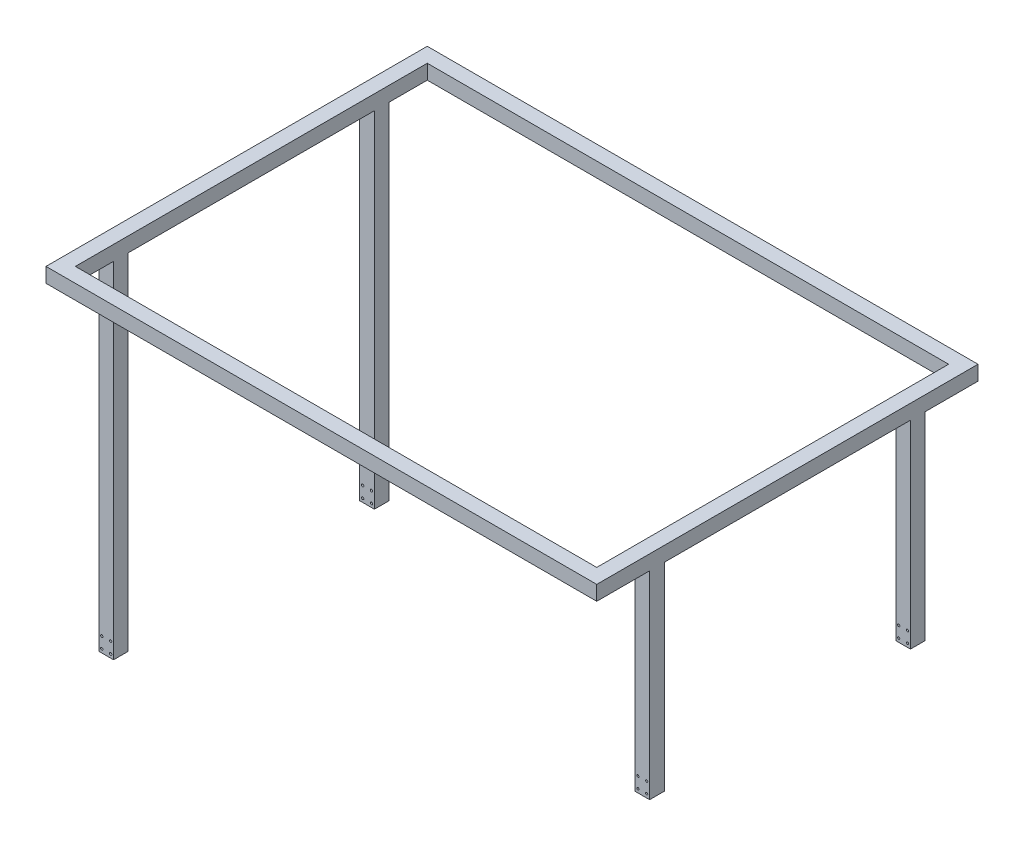
from build123d import *

# Parameters (mm, degrees)
SKETCH_1_W      = 750
SKETCH_1_H      = 519.2
SKETCH_1_W_2    = 710
SKETCH_1_H_2    = 479.2
EXTRUDE_1_DEPTH = 20
SKETCH_2_W      = 20
SKETCH_2_H      = 20
EXTRUDE_2_DEPTH = 470
SKETCH_6_W      = 20
SKETCH_6_H      = 20
EXTRUDE_4_DEPTH = 270
SKETCH_4_R      = 1.6
EXTRUDE1_DEPTH  = 30
SKETCH_7_R      = 1.5
EXTRUDE2_DEPTH  = 30


with BuildPart() as part:
    # 草图1 → 凸台-拉伸1 (new body)
    with BuildSketch(Plane(origin=(0, 0, 0), x_dir=(1, 0, 0), z_dir=(0, 1, 0))):
        with Locations((-25.365803698, -25.141816005)):
            Rectangle(SKETCH_1_W, SKETCH_1_H)
        with Locations((-25.365803698, -25.141816005)):
            Rectangle(SKETCH_1_W_2, SKETCH_1_H_2, mode=Mode.SUBTRACT)
    extrude(amount=EXTRUDE_1_DEPTH)

    # 草图2 → 凸台-拉伸2 (add)
    with BuildSketch(Plane.XZ):
        with Locations((-390.365803698, 202.741816005)):
            Rectangle(SKETCH_2_W, SKETCH_2_H)
    extrude_2 = extrude(amount=EXTRUDE_2_DEPTH)

    # 草图6 → 凸台-拉伸4 (add)
    with BuildSketch(Plane.XZ):
        with Locations((339.634196302, -152.458183995)):
            Rectangle(SKETCH_6_W, SKETCH_6_H)
    extrude_4 = extrude(amount=EXTRUDE_4_DEPTH)

    # 草图4 → Extrude1 (cut)
    with BuildSketch(Plane.XY.offset(212.741816005)):
        with Locations((-396.365803698, -465)):
            Circle(SKETCH_4_R)
        with Locations((-384.365803698, -465)):
            Circle(SKETCH_4_R)
        with Locations((-396.365803698, -450)):
            Circle(SKETCH_4_R)
        with Locations((-384.365803698, -450)):
            Circle(SKETCH_4_R)
    extrude1 = extrude(amount=-EXTRUDE1_DEPTH, mode=Mode.SUBTRACT)

    # 草图7 → Extrude2 (cut)
    with BuildSketch(Plane(origin=(0, 0, -162.458183995), x_dir=(-1, 0, 0), z_dir=(0, 0, -1))):
        with Locations((-345.634196302, -265)):
            Circle(SKETCH_7_R)
        with Locations((-333.634196302, -265)):
            Circle(SKETCH_7_R)
        with Locations((-345.634196302, -250)):
            Circle(SKETCH_7_R)
        with Locations((-333.634196302, -250)):
            Circle(SKETCH_7_R)
    extrude2 = extrude(amount=-EXTRUDE2_DEPTH, mode=Mode.SUBTRACT)

    # Mirror1: 凸台-拉伸2, 凸台-拉伸4, Extrude1, Extrude2 across plane
    add(extrude_2.mirror(Plane.XY.offset(25.141816005)))
    add(extrude_4.mirror(Plane.XY.offset(25.141816005)))
    add(extrude1.mirror(Plane.XY.offset(25.141816005)), mode=Mode.SUBTRACT)
    add(extrude2.mirror(Plane.XY.offset(25.141816005)), mode=Mode.SUBTRACT)


solid = part.part
